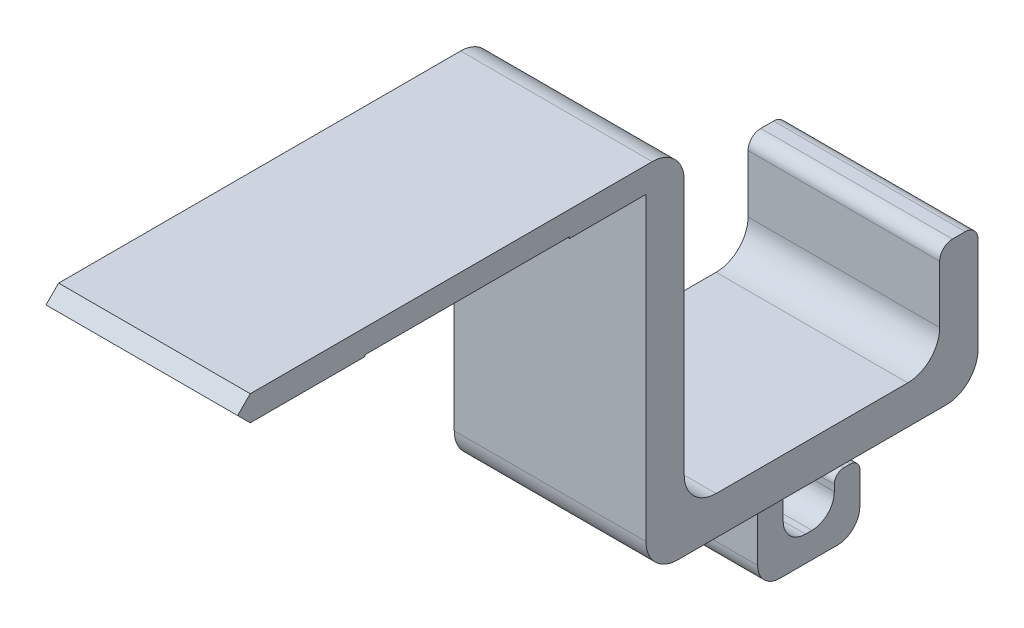
from build123d import *

# Parameters (mm, degrees)
BOSS_EXTRUDE1_DEPTH = 15
FILLET2_R           = 5
FILLET3_R           = 5
FILLET4_R           = 5
CHAMFER1_SIZE       = 2
BOSS_EXTRUDE2_DEPTH = 7.5
FILLET5_R           = 3
FILLET6_R           = 3.5
FILLET7_R           = 3.5
FILLET8_R           = 1.5
FILLET9_R           = 2


with BuildPart() as part:
    # Sketch1 → Boss-Extrude1 (new, symmetric)
    with BuildSketch(Plane(origin=(0, 0, 0), x_dir=(0, 0, -1), z_dir=(1, 0, 0))):
        Polygon((0, 0), (-15, 0), (-69.940788655, 0), (-69.940788655, -3.95), (-49.940788655, -3.95), (-49.940788655, -3.7), (-17.940788655, -3.7), (-17.940788655, -3.95), (-13.226857143, -3.95), (-6, -3.95), (-6, -56), (46, -56), (46, -34), (40, -34), (40, -50), (0, -50), align=None)
    extrude(amount=BOSS_EXTRUDE1_DEPTH, both=True)

    # Fillet2
    fillet2_edges = [part.edges().sort_by_distance(p)[0] for p in [
        (0, 0, 0),
    ]]
    fillet(fillet2_edges, radius=FILLET2_R)

    # Fillet3
    fillet3_edges = [part.edges().sort_by_distance(p)[0] for p in [
        (0, -50, 0),
        (0, -50, -40),
    ]]
    fillet(fillet3_edges, radius=FILLET3_R)

    # Fillet4
    fillet4_edges = [part.edges().sort_by_distance(p)[0] for p in [
        (0, -56, -46),
        (0, -56, 6),
    ]]
    fillet(fillet4_edges, radius=FILLET4_R)

    # Chamfer1
    # the kernel refuses this chamfer: 2 mm, written as the material it takes off along each edge
    with BuildSketch(Plane(origin=(-20.143365976, -3.95, 69.940788655), x_dir=(0, -0.027495876610586414, -0.9996219169112968), z_dir=(1, 0, 0))) as chamfer1_piece_1:
        Polygon((CHAMFER1_SIZE * 0.999621916911, CHAMFER1_SIZE * 0.0274958766106), (-CHAMFER1_SIZE * 0.0274958766106, CHAMFER1_SIZE * 0.999621916911), (0, 0), align=None)
    extrude(amount=40.286731952, mode=Mode.SUBTRACT)
    with BuildSketch(Plane(origin=(-20.143365976, 0, 69.940788655), x_dir=(0, 0.027495876610585952, -0.9996219169112968), z_dir=(1, 0, 0))) as chamfer1_piece_2:
        Polygon((CHAMFER1_SIZE * 0.999621916911, -CHAMFER1_SIZE * 0.0274958766106), (-CHAMFER1_SIZE * 0.0274958766106, -CHAMFER1_SIZE * 0.999621916911), (0, 0), align=None)
    extrude(amount=40.286731952, mode=Mode.SUBTRACT)

    # Sketch3 → Boss-Extrude2 (add, symmetric)
    with BuildSketch(Plane(origin=(0, 0, 0), x_dir=(0, 0, -1), z_dir=(1, 0, 0))):
        Polygon((19, -56), (19, -74), (35, -74), (35, -64), (31, -64), (31, -70), (23, -70), (23, -56), align=None)
    extrude(amount=BOSS_EXTRUDE2_DEPTH, both=True)

    # Fillet5
    fillet5_edges = [part.edges().sort_by_distance(p)[0] for p in [
        (0, -56, -23),
        (0, -56, -19),
    ]]
    fillet(fillet5_edges, radius=FILLET5_R)

    # Fillet6
    fillet6_edges = [part.edges().sort_by_distance(p)[0] for p in [
        (0, -70, -31),
        (0, -70, -23),
    ]]
    fillet(fillet6_edges, radius=FILLET6_R)

    # Fillet7
    fillet7_edges = [part.edges().sort_by_distance(p)[0] for p in [
        (0, -74, -19),
        (0, -74, -35),
    ]]
    fillet(fillet7_edges, radius=FILLET7_R)

    # Fillet8
    fillet8_edges = [part.edges().sort_by_distance(p)[0] for p in [
        (0, -64, -35),
        (0, -64, -31),
    ]]
    fillet(fillet8_edges, radius=FILLET8_R)

    # Fillet9
    fillet9_edges = [part.edges().sort_by_distance(p)[0] for p in [
        (0, -34, -40),
        (0, -34, -46),
    ]]
    fillet(fillet9_edges, radius=FILLET9_R)


solid = part.part
